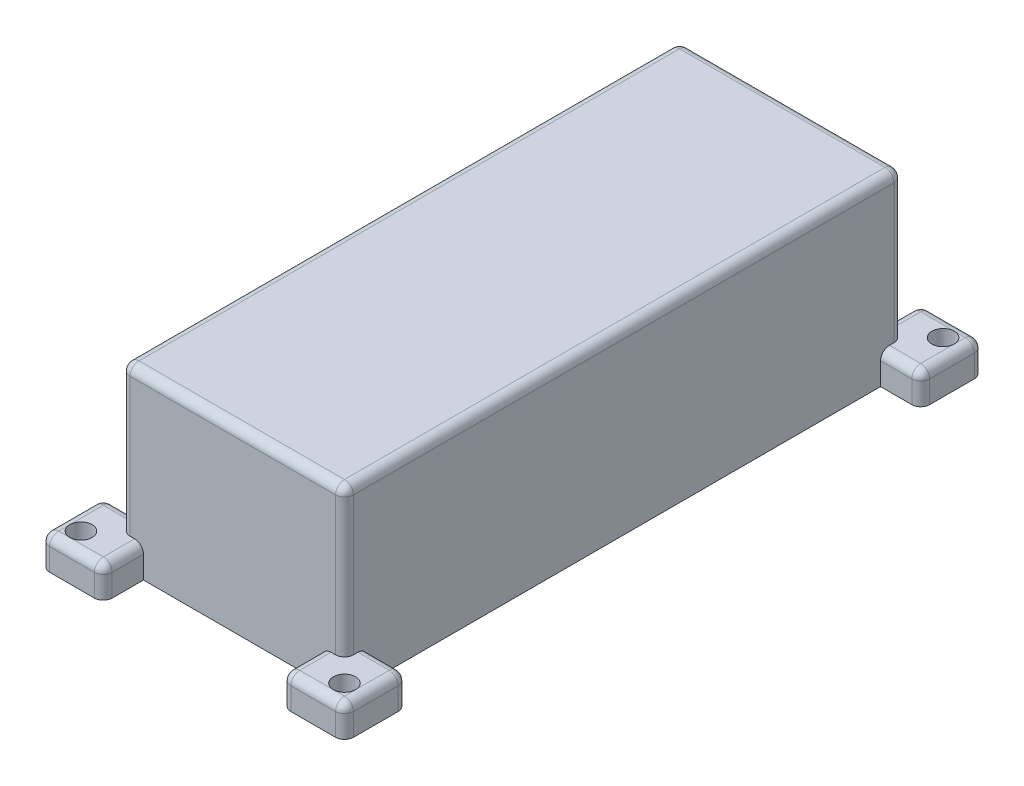
from build123d import *

# Parameters (mm, degrees)
SKETCH1_W                                  = 50
SKETCH1_H                                  = 125
BOSS_EXTRUDE1_DEPTH                        = 40
SHELL2_T                                   = -2
SKETCH3_R                                  = 2.5
BOSS_EXTRUDE2_DEPTH                        = 7
MIRROR2_AT_THE_SECOND_PLANE_COPY_1_SKETC_R = 2.5
MIRROR2_AT_THE_SECOND_PLANE_COPY_1_DEPTH   = 7
CUT_EXTRUDE1_REACH                         = 145.917
SKETCH4_W                                  = 10
SKETCH4_H                                  = 25
FILLET2_R                                  = 2
FILLET3_R                                  = 2


with BuildPart() as part:
    # Sketch1 → Boss-Extrude1 (new body)
    with BuildSketch(Plane(origin=(0, 0, 0), x_dir=(1, 0, 0), z_dir=(0, 1, 0))):
        Rectangle(SKETCH1_W, SKETCH1_H)
    extrude(amount=BOSS_EXTRUDE1_DEPTH)

    # Shell2
    shell2_openings = [part.faces().sort_by_distance(p)[0] for p in [
        (0, 0, 0),
    ]]
    offset(amount=SHELL2_T, openings=shell2_openings, kind=Kind.INTERSECTION)

    # Sketch3 → Boss-Extrude2 (add)
    with BuildSketch(Plane(origin=(0, 0, 0), x_dir=(1, 0, 0), z_dir=(0, 1, 0))):
        Polygon((25, -62.5), (20, -62.5), (20, -71.5), (34, -71.5), (34, -57.5), (25, -57.5), align=None)
        with Locations(Location((29.5, -67, 0), (0, 0, 270))):
            Circle(SKETCH3_R, mode=Mode.SUBTRACT)
    boss_extrude2 = extrude(amount=BOSS_EXTRUDE2_DEPTH)

    # Mirror2: Boss-Extrude2 across plane
    add(boss_extrude2.mirror(Plane.XY))

    # Mirror2 at the second plane: Boss-Extrude2 across plane
    add(boss_extrude2.mirror(Plane(origin=(0, 0, 0), x_dir=(0, 0, 1), z_dir=(1, 0, 0))))

    # Mirror2 at the second plane copy 1 sketc → Mirror2 at the second plane copy 1 (add)
    with BuildSketch(Plane(origin=(0, 0, 0), x_dir=(-1, 0, 0), z_dir=(0, 1, 0))):
        Polygon((25, -62.5), (20, -62.5), (20, -71.5), (34, -71.5), (34, -57.5), (25, -57.5), align=None)
        with Locations(Location((29.5, -67, 0), (0, 0, 270))):
            Circle(MIRROR2_AT_THE_SECOND_PLANE_COPY_1_SKETC_R, mode=Mode.SUBTRACT)
    extrude(amount=MIRROR2_AT_THE_SECOND_PLANE_COPY_1_DEPTH)

    # Sketch4 → Cut-Extrude1 (cut, up to next)
    with BuildSketch(Plane(origin=(0, 0, -62.5), x_dir=(-1, 0, 0), z_dir=(0, 0, -1)), mode=Mode.PRIVATE) as cut_extrude1_sk1:
        with Locations((0, 12.5)):
            Rectangle(SKETCH4_W, SKETCH4_H)
    cut_extrude1_tool1 = extrude(cut_extrude1_sk1.sketch, amount=-CUT_EXTRUDE1_REACH, mode=Mode.PRIVATE) & part.part
    add(cut_extrude1_tool1.solids().sort_by_distance((0, 12.5, -62.5))[0], mode=Mode.SUBTRACT)

    # Fillet2
    fillet2_edges = [part.edges().sort_by_distance(p)[0] for p in [
        (-25, 40, 0),
        (0, 40, 62.5),
        (20, 7, 67),
        (27, 7, 71.5),
        (34, 7, 64.5),
        (29.5, 7, 57.5),
        (20, 3.5, 71.5),
        (34, 3.5, 71.5),
        (34, 3.5, 57.5),
        (-29.5, 7, 57.5),
        (-34, 7, 64.5),
        (-34, 3.5, 57.5),
        (25, 40, 0),
        (-27, 7, 71.5),
        (-34, 3.5, 71.5),
        (-20, 7, 67),
        (-20, 3.5, 71.5),
        (29.5, 7, -57.5),
        (34, 7, -64.5),
        (34, 3.5, -57.5),
        (27, 7, -71.5),
        (34, 3.5, -71.5),
        (20, 7, -67),
        (20, 3.5, -71.5),
        (25, 23.5, 62.5),
        (-25, 23.5, 62.5),
        (-25, 23.5, -62.5),
        (25, 23.5, -62.5),
        (-20, 7, -67),
        (-27, 7, -71.5),
        (-34, 7, -64.5),
        (-29.5, 7, -57.5),
        (-20, 3.5, -71.5),
        (-34, 3.5, -71.5),
        (-34, 3.5, -57.5),
        (0, 40, -62.5),
    ]]
    fillet(fillet2_edges, radius=FILLET2_R - 0.0001)  # a hair under: the kernel refuses the full size

    # Fillet3
    fillet3_edges = [part.edges().sort_by_distance(p)[0] for p in [
        (5, 25, -61.5),
        (-5, 25, -61.5),
    ]]
    fillet(fillet3_edges, radius=FILLET3_R)


solid = part.part
